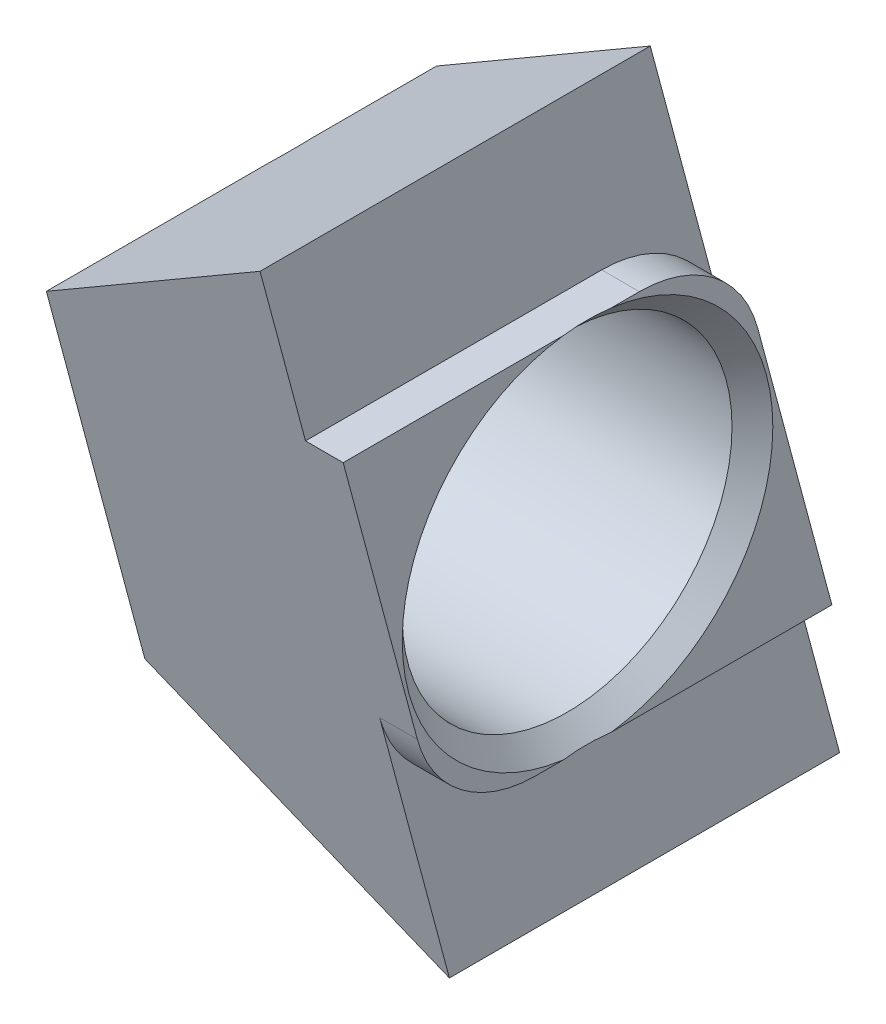
from build123d import *

# Parameters (mm, degrees)
EXTRUDE1_DEPTH       = 0.8
EXTRUDE2_DEPTH       = 5.5
DRAFT1_ANGLE         = -33.206570315
DRAFT2_ANGLE         = -33.206570315
M6_CLEARANCE_HOLE1_D = 7
CHAMFER1_SIZE        = 0.433


with BuildPart() as part:
    # Sketch1 → Extrude1 (new body)
    with BuildSketch(Plane(origin=(0, 0, 0), x_dir=(0, 0, -1), z_dir=(1, 0, 0))):
        with BuildLine():
            Line((1.101052702, 3.9), (-5.186106572, 3.9))
            Line((-5.186106572, 3.9), (-3.612459851, -1.972929517))
            ThreePointArc((-3.612459851, -1.972929517), (-2.683832418, -3.362718685), (-1.101052702, -3.9))
            Line((-1.101052702, -3.9), (5.186106572, -3.9))
            Line((5.186106572, -3.9), (3.612459851, 1.972929517))
            ThreePointArc((3.612459851, 1.972929517), (2.683832418, 3.362718685), (1.101052702, 3.9))
        make_face()
    extrude(amount=-EXTRUDE1_DEPTH)

    # Sketch2 → Extrude2 (add)
    with BuildSketch(Plane.ZY.offset(0.8)):
        with BuildLine():
            Line((2.131485778, -7.5), (-6.150723665, -7.5))
            add(Edge.make_bspline(
                [(-2.131485778, 7.5), (-3.471231741, 2.5), (-4.810977703, -2.5), (-6.150723665, -7.5)],
                knots=[0, 0, 0, 0, 1, 1, 1, 1], degree=3))
            Line((-2.131485778, 7.5), (6.150723665, 7.5))
            add(Edge.make_bspline(
                [(2.131485778, -7.5), (3.471231741, -2.5), (4.810977703, 2.5), (6.150723665, 7.5)],
                knots=[0, 0, 0, 0, 1, 1, 1, 1], degree=3))
        make_face()
    extrude(amount=EXTRUDE2_DEPTH)

    # Draft1
    draft1_faces = [part.faces().sort_by_distance(p)[0] for p in [
        (-3.55, 7.5, 2.009618943),
    ]]
    draft(draft1_faces, Plane(origin=(-0.8, 0, 4.141104722), x_dir=(0, 0, 1), z_dir=(1, 0, 0)), DRAFT1_ANGLE)

    # Draft2
    draft2_faces = [part.faces().sort_by_distance(p)[0] for p in [
        (-3.55, -7.5, -2.009618943),
    ]]
    draft(draft2_faces, Plane(origin=(-0.8, 0, 4.141104722), x_dir=(0, 0, 1), z_dir=(1, 0, 0)), DRAFT2_ANGLE)

    # M6 Clearance Hole1 (through all)
    with Locations(Plane.ZY.offset(6.3)):
        with Locations((0, 0)):
            Hole(M6_CLEARANCE_HOLE1_D / 2)

    # Chamfer1
    # the kernel refuses this chamfer: 0.433 mm, written as the material it takes off along each edge
    with BuildSketch(Plane(origin=(0, 0, 0), x_dir=(0, 0, -1), z_dir=(0, -1, 0))) as chamfer1_piece_1:
        Polygon((3.5 + CHAMFER1_SIZE, 0), (3.5, -CHAMFER1_SIZE), (3.5, 0), align=None)
    revolve(axis=Axis((0, 0, 0), (1, 0, 0)), mode=Mode.SUBTRACT)
    with BuildSketch(Plane(origin=(-6.3, 0, 0), x_dir=(0, 0, -1), z_dir=(0, -1, 0))) as chamfer1_piece_2:
        Polygon((3.5 + CHAMFER1_SIZE, 0), (3.5, CHAMFER1_SIZE), (3.5, 0), align=None)
    revolve(axis=Axis((-6.3, 0, 0), (1, 0, 0)), mode=Mode.SUBTRACT)


solid = part.part
